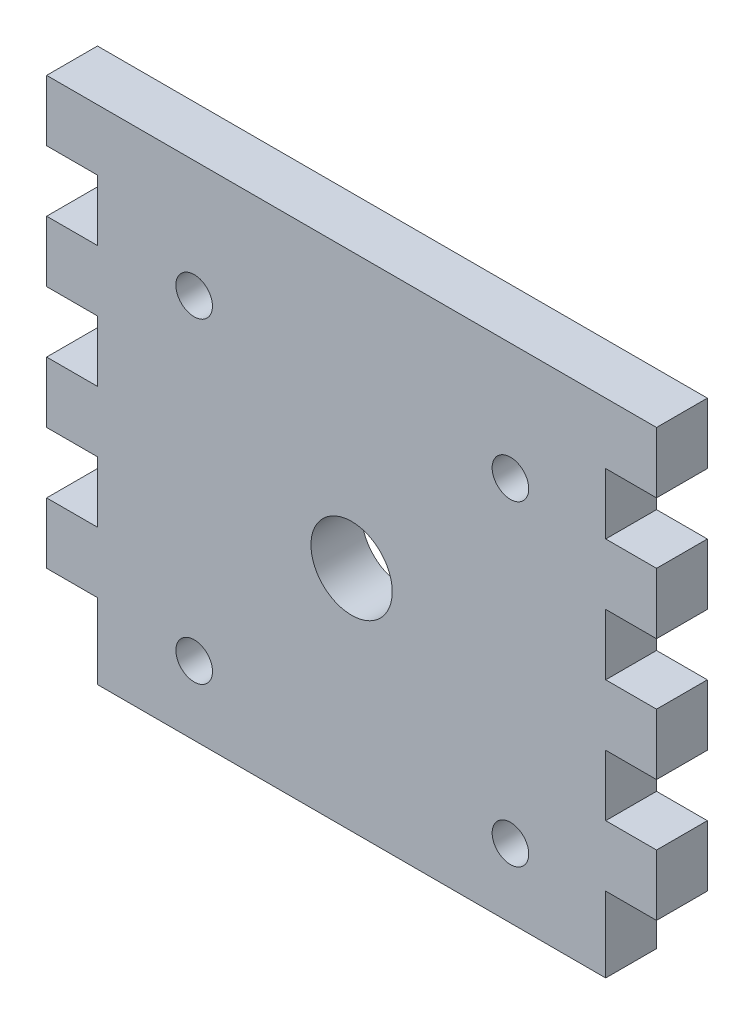
from build123d import *

# Parameters (mm, degrees)
SKETCH1_W           = 76.2
SKETCH1_H           = 76.2
BOSS_EXTRUDE1_DEPTH = 6.35
CUT_EXTRUDE1_DEPTH  = 6.35
SKETCH3_W           = 6.35
SKETCH3_H           = 38.1
CUT_EXTRUDE2_DEPTH  = 6.35
SKETCH4_W           = 6.35
SKETCH4_H           = 7.62
BOSS_EXTRUDE3_DEPTH = 6.35
SKETCH5_W           = 63.5
SKETCH5_H           = 6.35
CUT_EXTRUDE3_DEPTH  = 7.62
SKETCH6_R           = 5.08
SKETCH6_R_2         = 2.286
CUT_EXTRUDE4_DEPTH  = 71.769022866
SKETCH7_W           = 6.35
SKETCH7_H           = 7.62
BOSS_EXTRUDE4_DEPTH = 6.35
SKETCH9_W           = 63.5
SKETCH9_H           = 5.835909299
CUT_EXTRUDE5_DEPTH  = 6.35


with BuildPart() as part:
    # Sketch1 → Boss-Extrude1 (new body)
    with BuildSketch(Plane.XY):
        with Locations((0.21991342, -21.056709957)):
            Rectangle(SKETCH1_W, SKETCH1_H)
    extrude(amount=BOSS_EXTRUDE1_DEPTH)

    # Sketch2 → Cut-Extrude1 (cut)
    with BuildSketch(Plane.XY.offset(6.35)):
        Polygon((-37.88008658, 17.043290043), (-31.53008658, 17.043290043), (-31.53008658, 9.423290043), (-37.88008658, 9.423290043), (-37.88008658, 1.803290043), (-31.53008658, 1.803290043), (-31.53008658, -5.816709957), (-37.88008658, -5.816709957), (-37.88008658, -13.436709957), (-31.53008658, -13.436709957), (-31.53008658, -21.056709957), (-37.88008658, -21.056709957), (-46.725849744, -21.056709957), (-46.725849744, 17.043290043), align=None)
        Polygon((47.165676584, -21.056709957), (47.165676584, 17.043290043), (38.31991342, 17.043290043), (31.96991342, 17.043290043), (31.96991342, 9.423290043), (38.31991342, 9.423290043), (38.31991342, 1.803290043), (31.96991342, 1.803290043), (31.96991342, -5.816709957), (38.31991342, -5.816709957), (38.31991342, -13.436709957), (31.96991342, -13.436709957), (31.96991342, -21.056709957), (38.31991342, -21.056709957), align=None)
    extrude(amount=-CUT_EXTRUDE1_DEPTH, mode=Mode.SUBTRACT)

    # Sketch3 → Cut-Extrude2 (cut)
    with BuildSketch(Plane.XY.offset(6.35)):
        with Locations((-34.70508658, -40.106709957)):
            Rectangle(SKETCH3_W, SKETCH3_H)
        with Locations((35.14491342, -40.106709957)):
            Rectangle(SKETCH3_W, SKETCH3_H)
    extrude(amount=-CUT_EXTRUDE2_DEPTH, mode=Mode.SUBTRACT)

    # Sketch4 → Boss-Extrude3 (add)
    with BuildSketch(Plane.XY.offset(6.35)):
        with Locations((-34.70508658, -24.866709957)):
            Rectangle(SKETCH4_W, SKETCH4_H)
        with Locations((35.14491342, -24.866709957)):
            Rectangle(SKETCH4_W, SKETCH4_H)
    extrude(amount=-BOSS_EXTRUDE3_DEPTH)

    # Sketch5 → Cut-Extrude3 (cut)
    with BuildSketch(Plane(origin=(0, 17.043290043, 0), x_dir=(1, 0, 0), z_dir=(0, 1, 0))):
        with Locations((0.21991342, -3.175)):
            Rectangle(SKETCH5_W, SKETCH5_H)
    extrude(amount=-CUT_EXTRUDE3_DEPTH, mode=Mode.SUBTRACT)

    # Sketch6 → Cut-Extrude4 (cut, through all)
    with BuildSketch(Plane.XY.offset(6.35)):
        with Locations((0.21991342, -24.866709957)):
            Circle(SKETCH6_R)
        with Locations((-19.446847485, -5.199949052)):
            Circle(SKETCH6_R_2)
        with Locations((20.066279447, -5.199949052)):
            Circle(SKETCH6_R_2)
        with Locations((20.066279447, -44.713075984)):
            Circle(SKETCH6_R_2)
        with Locations((-19.446847485, -44.713075984)):
            Circle(SKETCH6_R_2)
    extrude(amount=-CUT_EXTRUDE4_DEPTH, mode=Mode.SUBTRACT)

    # Sketch7 → Boss-Extrude4 (add)
    with BuildSketch(Plane.XY.offset(6.35)):
        with Locations((-34.70508658, -40.106709957)):
            Rectangle(SKETCH7_W, SKETCH7_H)
        with Locations((35.14491342, -40.106709957)):
            Rectangle(SKETCH7_W, SKETCH7_H)
    extrude(amount=-BOSS_EXTRUDE4_DEPTH)

    # Sketch9 → Cut-Extrude5 (cut)
    with BuildSketch(Plane.XY.offset(6.35)):
        with Locations((0.21991342, -56.238755307)):
            Rectangle(SKETCH9_W, SKETCH9_H)
    extrude(amount=-CUT_EXTRUDE5_DEPTH, mode=Mode.SUBTRACT)


solid = part.part
